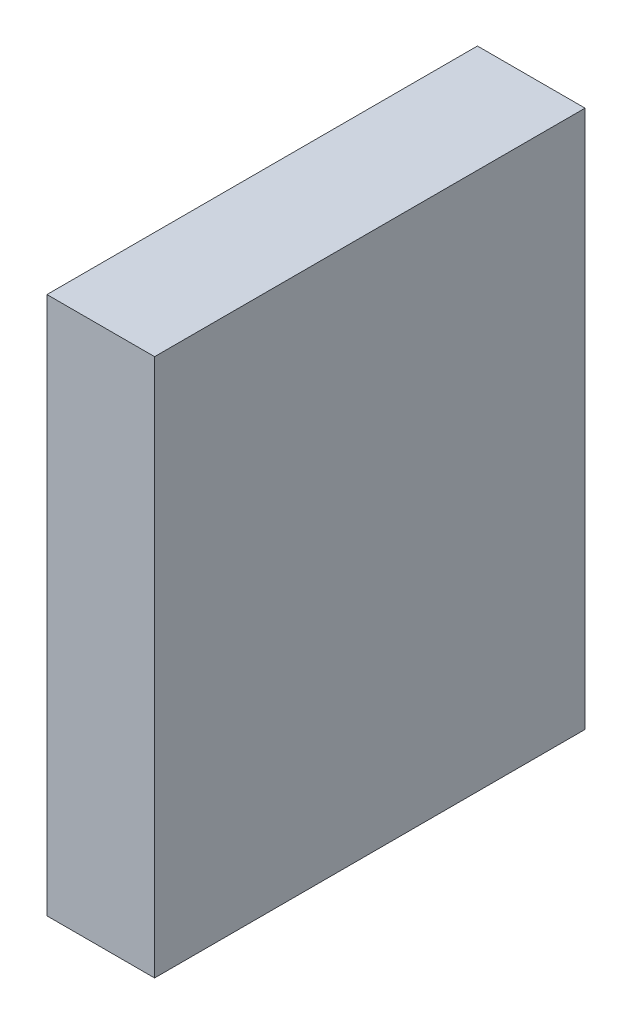
from build123d import *

# Parameters (mm, degrees)
SKETCH1_W           = 40
SKETCH1_H           = 50
BOSS_EXTRUDE1_DEPTH = 10


with BuildPart() as part:
    # Sketch1 → Boss-Extrude1 (new body)
    with BuildSketch(Plane(origin=(0, 0, 0), x_dir=(0, 0, -1), z_dir=(1, 0, 0))):
        Rectangle(SKETCH1_W, SKETCH1_H)
    extrude(amount=BOSS_EXTRUDE1_DEPTH)


solid = part.part
